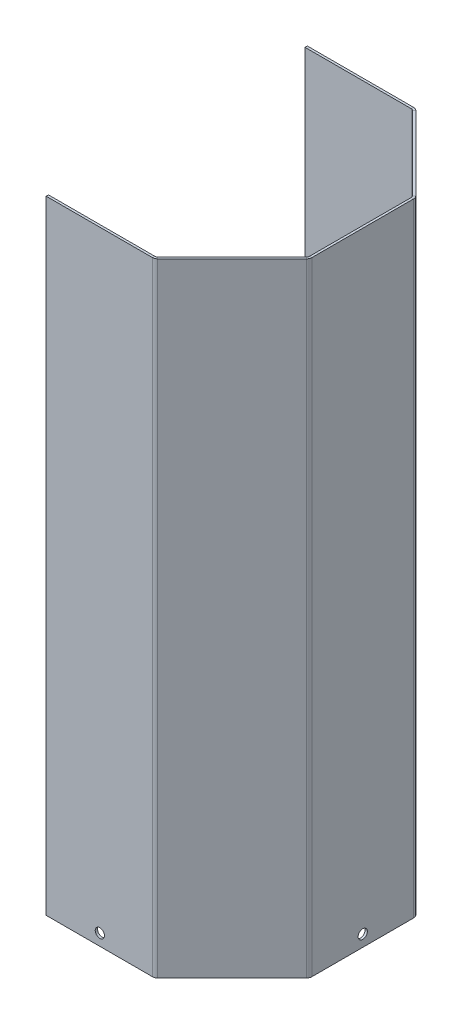
from build123d import *

# Parameters (mm, degrees)
SM_BASE_FLANGE_1_DEPTH = 270
SKETCH_2_R             = 2
CUT_EXTRUDE_1_DEPTH    = 137
SKETCH_3_R             = 2
CUT_EXTRUDE_2_DEPTH    = 10


# Sheet-metal steps are written as plain solids
with BuildPart() as part:
    # Sketch 1 → Базовая кромка1 (new body)
    with BuildSketch(Plane(origin=(0, 0, 0), x_dir=(1, 0, 0), z_dir=(0, 1, 0))):
        with BuildLine():
            Line((-3.932431311, 56.4), (42.156298852, 56.4))
            ThreePointArc((42.156298852, 56.4), (42.998202403, 56.232534972), (43.71193377, 55.755634919))
            Line((43.71193377, 55.755634919), (75.834350896, 23.633217793))
            ThreePointArc((75.834350896, 23.633217793), (76.311250949, 22.919486426), (76.478715977, 22.077582874))
            Line((76.478715977, 22.077582874), (76.478715977, -22.077582874))
            ThreePointArc((76.478715977, -22.077582874), (76.311250949, -22.919486426), (75.834350896, -23.633217793))
            Line((75.834350896, -23.633217793), (43.51193377, -55.955634919))
            ThreePointArc((43.51193377, -55.955634919), (42.798202403, -56.432534972), (41.956298852, -56.6))
            Line((41.956298852, -56.6), (-4.132431311, -56.6))
            Line((-4.132431311, -56.6), (-4.132431311, -55.6))
            Line((-4.132431311, -55.6), (41.956298852, -55.6))
            ThreePointArc((41.956298852, -55.6), (42.41551897, -55.508655439), (42.804826989, -55.248528137))
            Line((42.804826989, -55.248528137), (75.127244115, -22.926111012))
            ThreePointArc((75.127244115, -22.926111012), (75.387371416, -22.536802993), (75.478715977, -22.077582874))
            Line((75.478715977, -22.077582874), (75.478715977, 22.077582874))
            ThreePointArc((75.478715977, 22.077582874), (75.387371416, 22.536802993), (75.127244115, 22.926111012))
            Line((75.127244115, 22.926111012), (43.004826989, 55.048528137))
            ThreePointArc((43.004826989, 55.048528137), (42.61551897, 55.308655439), (42.156298852, 55.4))
            Line((42.156298852, 55.4), (-3.932431311, 55.4))
            Line((-3.932431311, 55.4), (-3.932431311, 56.4))
        make_face()
    extrude(amount=SM_BASE_FLANGE_1_DEPTH)

    # Эскиз2 → Вырез-Вытянуть1 (cut)
    with BuildSketch(Plane(origin=(0, 0, -56.4), x_dir=(-1, 0, 0), z_dir=(0, 0, -1))):
        with Locations((-19.11193377, 5)):
            Circle(SKETCH_2_R)
    extrude(amount=-CUT_EXTRUDE_1_DEPTH, mode=Mode.SUBTRACT)

    # Эскиз3 → Вырез-Вытянуть2 (cut)
    with BuildSketch(Plane(origin=(76.478715977, 0, 0), x_dir=(0, 0, -1), z_dir=(1, 0, 0))):
        with Locations((0, 5)):
            Circle(SKETCH_3_R)
    extrude(amount=-CUT_EXTRUDE_2_DEPTH, mode=Mode.SUBTRACT)


solid = part.part
